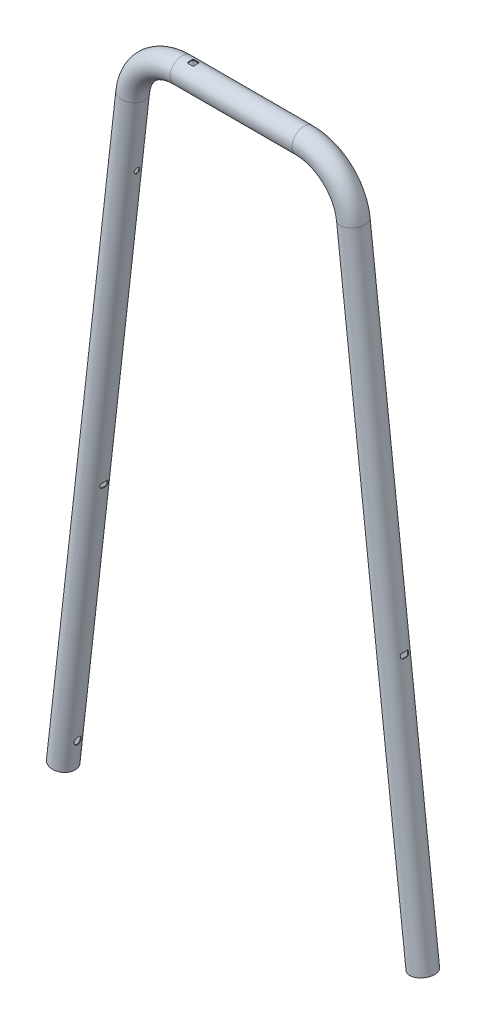
from build123d import *

# Parameters (mm, degrees)
SKETCH2_R                       = 13.2
SKETCH2_R_2                     = 12.4
SKETCH17_R                      = 4.05
CUT_EXTRUDE6_DEPTH              = 50
CUT_EXTRUDE7_DEPTH              = 50
SKETCH19_R                      = 4
CUT_EXTRUDE8_DEPTH              = 50
SKETCH20_R                      = 3.5
CUT_EXTRUDE9_DEPTH              = 50
CUT_EXTRUDE10_DEPTH             = 10
CUT_EXTRUDE11_REACH             = 850.9
SKETCH22_R                      = 3.05
CUT_EXTRUDE11_DIRECTION_2_REACH = 850.9


with BuildPart() as part:
    # Sweep2: sweep along a path in Sketch1
    with BuildLine(Plane.XY) as sweep2_path:
        Line((199.081116353, -162.284032228), (122.151864618, 518.194454139))
        ThreePointArc((122.151864618, 518.194454139), (104.141392235, 553.033139482), (67.5, 567.015967772))
        Line((67.5, 567.015967772), (-67.5, 567.015967772))
        ThreePointArc((-67.5, 567.015967772), (-104.141392235, 553.033139482), (-122.151864618, 518.194454139))
        Line((-122.151864618, 518.194454139), (-199.081116353, -162.284032228))
    # Sketch2 → Sweep2 (sweep)
    with BuildSketch(Plane(origin=(-199.081116353, -162.284032228, 0), x_dir=(-0.9936702657801585, 0.11233611576153561, 0), z_dir=(-0.11233611576153563, -0.9936702657801586, 0))):
        Circle(SKETCH2_R)
        Circle(SKETCH2_R_2, mode=Mode.SUBTRACT)
    sweep(path=sweep2_path.line)

    # Sketch17 → Cut-Extrude6 (cut)
    with BuildSketch(Plane(origin=(-199.081116353, -162.284032228, 0), x_dir=(0, 0, 1), z_dir=(-0.9936702657801584, 0.11233611576153771, 0))):
        with Locations((0, 30)):
            Circle(SKETCH17_R)
    cut_extrude6 = extrude(amount=-CUT_EXTRUDE6_DEPTH, mode=Mode.SUBTRACT)

    # Sketch18 → Cut-Extrude7 (cut, symmetric)
    with BuildSketch(Plane(origin=(-199.081116353, -162.284032228, 0), x_dir=(0, 0, 1), z_dir=(-0.9936702657801584, 0.11233611576153771, 0))):
        with BuildLine():
            Line((-2.5, 294.75), (2.5, 294.75))
            ThreePointArc((2.5, 294.75), (3.914213562, 294.164213562), (4.5, 292.75))
            Line((4.5, 292.75), (4.5, 291.25))
            ThreePointArc((4.5, 291.25), (3.914213562, 289.835786438), (2.5, 289.25))
            Line((2.5, 289.25), (-2.5, 289.25))
            ThreePointArc((-2.5, 289.25), (-3.914213562, 289.835786438), (-4.5, 291.25))
            Line((-4.5, 291.25), (-4.5, 292.75))
            ThreePointArc((-4.5, 292.75), (-3.914213562, 294.164213562), (-2.5, 294.75))
        make_face()
    cut_extrude7 = extrude(amount=CUT_EXTRUDE7_DEPTH, both=True, mode=Mode.SUBTRACT)

    # Mirror2: Cut-Extrude6, Cut-Extrude7 across plane
    add(cut_extrude6.mirror(Plane(origin=(0, 0, 0), x_dir=(0, 0, 1), z_dir=(1, 0, 0))), mode=Mode.SUBTRACT)
    add(cut_extrude7.mirror(Plane(origin=(0, 0, 0), x_dir=(0, 0, 1), z_dir=(1, 0, 0))), mode=Mode.SUBTRACT)

    # Sketch19 → Cut-Extrude8 (cut)
    with BuildSketch(Plane(origin=(-199.081116353, -162.284032228, 0), x_dir=(0, 0, 1), z_dir=(-0.9936702657801584, 0.11233611576153771, 0))):
        with Locations((0, 513)):
            Circle(SKETCH19_R)
    extrude(amount=CUT_EXTRUDE8_DEPTH, mode=Mode.SUBTRACT)

    # Sketch20 → Cut-Extrude9 (cut)
    with BuildSketch(Plane(origin=(0, 580.215967772, 0), x_dir=(1, 0, 0), z_dir=(0, 1, 0))):
        with Locations((-54.851864618, 0)):
            Circle(SKETCH20_R)
    extrude(amount=-CUT_EXTRUDE9_DEPTH, mode=Mode.SUBTRACT)

    # Sketch21 → Cut-Extrude10 (cut)
    with BuildSketch(Plane(origin=(0, 580.215967772, 0), x_dir=(1, 0, 0), z_dir=(0, 1, 0))):
        with BuildLine():
            Line((-57.351864618, -3.5), (-52.351864618, -3.5))
            ThreePointArc((-52.351864618, -3.5), (-51.644757837, -3.207106781), (-51.351864618, -2.5))
            Line((-51.351864618, -2.5), (-51.351864618, 2.5))
            ThreePointArc((-51.351864618, 2.5), (-51.644757837, 3.207106781), (-52.351864618, 3.5))
            Line((-52.351864618, 3.5), (-57.351864618, 3.5))
            ThreePointArc((-57.351864618, 3.5), (-58.058971399, 3.207106781), (-58.351864618, 2.5))
            Line((-58.351864618, 2.5), (-58.351864618, -2.5))
            ThreePointArc((-58.351864618, -2.5), (-58.058971399, -3.207106781), (-57.351864618, -3.5))
        make_face()
    extrude(amount=-CUT_EXTRUDE10_DEPTH, mode=Mode.SUBTRACT)

    # Sketch22 → Cut-Extrude11 (cut, up to next)
    with BuildSketch(Plane(origin=(-199.081116353, -162.284032228, 0), x_dir=(0, 0, 1), z_dir=(-0.9936702657801584, 0.11233611576153771, 0)), mode=Mode.PRIVATE) as cut_extrude11_sk1:
        with Locations((0, 613)):
            Circle(SKETCH22_R)
    cut_extrude11_tool1 = extrude(cut_extrude11_sk1.sketch, amount=-CUT_EXTRUDE11_REACH, mode=Mode.PRIVATE) & part.part
    add(cut_extrude11_tool1.solids().sort_by_distance((-130.219077, 446.835841, 0))[0], mode=Mode.SUBTRACT)

    # Sketch22 → Cut-Extrude11 direction 2 (cut, up to next)
    with BuildSketch(Plane(origin=(-199.081116353, -162.284032228, 0), x_dir=(0, 0, 1), z_dir=(-0.9936702657801584, 0.11233611576153771, 0)), mode=Mode.PRIVATE) as cut_extrude11_direction_2_sk1:
        with Locations((0, 613)):
            Circle(SKETCH22_R)
    cut_extrude11_direction_2_tool1 = extrude(cut_extrude11_direction_2_sk1.sketch, amount=CUT_EXTRUDE11_DIRECTION_2_REACH, mode=Mode.PRIVATE) & part.part
    add(cut_extrude11_direction_2_tool1.solids().sort_by_distance((-130.219077, 446.835841, 0))[0], mode=Mode.SUBTRACT)


solid = part.part
